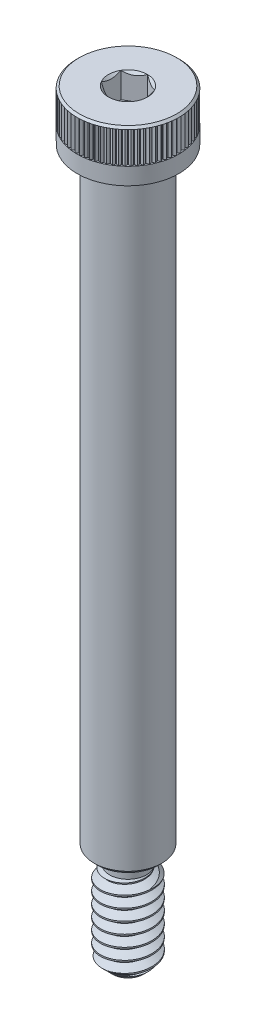
from build123d import *

# Parameters (mm, degrees)
SKETCH1_R          = 4.7625
EXTRUDE1_DEPTH     = 4.7625
CUT_EXTRUDE1_DEPTH = 2.38125
SKETCH4_R          = 3.175
EXTRUDE2_DEPTH     = 57.15
SKETCH5_R          = 2.413
EXTRUDE3_DEPTH     = 9.525
CHAMFER1_SIZE      = 0.9525
CUT_SWEEP1_PITCH   = 1.058333333
CUT_SWEEP1_TO      = 9.525
CUT_EXTRUDE3_DEPTH = 2.980765865
CHAMFER2_SIZE      = 0.194234135
CIRPATTERN2_COUNT  = 72
CHAMFER3_SIZE      = 0.352777778


with BuildPart() as part:
    # Sketch1 → Extrude1 (new body)
    with BuildSketch(Plane(origin=(0, 0, 0), x_dir=(1, 0, 0), z_dir=(0, 1, 0))):
        with Locations(Location((0, 0, 0), (0, 0, 90))):
            Circle(SKETCH1_R)
    extrude(amount=EXTRUDE1_DEPTH)

    # Sketch2 → Cut-Extrude1 (cut)
    with BuildSketch(Plane(origin=(0, 4.7625, 0), x_dir=(-1, 0, 0), z_dir=(0, 1, 0))):
        Polygon((0, -1.833087105), (1.5875, -0.916543552), (1.5875, 0.916543552), (0, 1.833087105), (-1.5875, 0.916543552), (-1.5875, -0.916543552), align=None)
    extrude(amount=-CUT_EXTRUDE1_DEPTH, mode=Mode.SUBTRACT)

    # Sketch4 → Extrude2 (add)
    with BuildSketch(Plane.XZ):
        with Locations(Location((0, 0, 0), (0, 0, 90))):
            Circle(SKETCH4_R)
    extrude(amount=EXTRUDE2_DEPTH)

    # Sketch5 → Extrude3 (add)
    with BuildSketch(Plane.XZ.offset(57.15)):
        with Locations(Location((0, 0, 0), (0, 0, 90))):
            Circle(SKETCH5_R)
    extrude(amount=EXTRUDE3_DEPTH)

    # Chamfer1
    chamfer1_edges = [part.edges().sort_by_distance(p)[0] for p in [
        (0, -66.675, -2.413),
    ]]
    chamfer(chamfer1_edges, length=CHAMFER1_SIZE)

    # Cut-Sweep1: arcs per turn and ends read off the stored shape
    # Cut-Sweep1: the profile of Sketch13 profile screwed along a right-hand helix through 11 turns, 6 arcs to a turn; built about Z, then put on its axis
    cut_sweep1_z = Axis((0, 0, 0), (0, 0, 1))
    cut_sweep1_corners = [(2.4133, 0, -0.132118462), (2.4133, 0, -1.058506538), (1.725592336, 0, -0.661458333), (1.725592336, 0, -0.529166667)]
    with BuildLine(mode=Mode.PRIVATE) as cut_sweep1_profile:
        Line(cut_sweep1_corners[0], cut_sweep1_corners[1])
        Line(cut_sweep1_corners[1], cut_sweep1_corners[2])
        Line(cut_sweep1_corners[2], cut_sweep1_corners[3])
        Line(cut_sweep1_corners[3], cut_sweep1_corners[0])
    cut_sweep1_cap = Face(cut_sweep1_profile.wire())
    cut_sweep1_turn_angles = [0, 30, 60, 90, 120, 150, 180, 210, 240, 270, 300, 330, 360]
    cut_sweep1_turn_weights = [1, 0.8660254037844387, 1, 0.8660254037844387, 1, 0.8660254037844387, 1, 0.8660254037844387, 1, 0.8660254037844387, 1, 0.8660254037844387, 1]
    cut_sweep1_turn_rails = [Edge.make_bspline([Vector(p[0], p[1], 0).rotate(cut_sweep1_z, cut_sweep1_turn_angles[k]) / cut_sweep1_turn_weights[k] + Vector(0, 0, p[2] + CUT_SWEEP1_PITCH * cut_sweep1_turn_angles[k] / 360) for k in range(13)], [0, 0, 0, 1, 1, 2, 2, 3, 3, 4, 4, 5, 5, 6, 6, 6], 2, cut_sweep1_turn_weights) for p in cut_sweep1_corners]
    cut_sweep1_turn_sides = [Face.make_surface_from_curves(cut_sweep1_turn_rails[p[0]], cut_sweep1_turn_rails[p[1]]) for p in [(0, 1), (1, 2), (2, 3), (3, 0)]]
    cut_sweep1 = Plane(origin=(0, -66.675, 0), x_dir=(0.7071067811865439, 0, 0.7071067811865512), z_dir=(0, 1, 0)) * split(Solid(Shell([*[p.moved(Location((0, 0, CUT_SWEEP1_PITCH * i))) for i in range(11) for p in cut_sweep1_turn_sides], cut_sweep1_cap, cut_sweep1_cap.rotate(cut_sweep1_z, 3960).moved(Location((0, 0, CUT_SWEEP1_PITCH * 3960 / 360)))])), bisect_by=Plane.XY.offset(CUT_SWEEP1_TO), keep=Keep.BOTTOM, mode=Mode.PRIVATE)
    add(cut_sweep1, mode=Mode.SUBTRACT)

    # Sketch18 → Cut-Revolve1 (revolve, cut)
    with BuildSketch(Plane.XY, mode=Mode.PRIVATE) as cut_revolve1_sk:
        Polygon((2.413, -57.15), (1.725592336, -57.15), (1.725592336, -58.472916667), (2.413, -59.160324331), align=None)
    revolve(cut_revolve1_sk.sketch.rotate(Axis((0, -57.15, 0), (0, 1, 0)), 270.693182205), axis=Axis((0, -57.15, 0), (0, 1, 0)), mode=Mode.SUBTRACT)

    # Sketch10 → Cut-Extrude3 (cut)
    with BuildSketch(Plane(origin=(0, 1.5875, 0), x_dir=(-1, 0, 0), z_dir=(0, 1, 0))):
        with BuildLine():
            Line((-4.757967155, -0.207737332), (-4.827695054, -0.210781718))
            Line((-4.827695054, -0.210781718), (-4.827695054, 0.210781718))
            Line((-4.827695054, 0.210781718), (-4.757967155, 0.207737332))
            Line((-4.757967155, 0.207737332), (-4.581019273, 0.03078945))
            ThreePointArc((-4.581019273, 0.03078945), (-4.568265865, 0), (-4.581019273, -0.03078945))
            Line((-4.581019273, -0.03078945), (-4.757967155, -0.207737332))
        make_face()
    cut_extrude3 = extrude(amount=CUT_EXTRUDE3_DEPTH, mode=Mode.SUBTRACT)

    # Chamfer2
    chamfer2_edges = [part.edges().sort_by_distance(p)[0] for p in [
        (0, 4.7625, 4.7625),
    ]]
    chamfer(chamfer2_edges, length=CHAMFER2_SIZE - 0.0001)  # a hair under: the kernel refuses the full size

    # CirPattern2: Cut-Extrude3 ×72 about axis
    cirpattern2_axis = Axis((0, 0, 0), (0, 1, 0))
    for i in range(1, CIRPATTERN2_COUNT):
        add(cut_extrude3.rotate(cirpattern2_axis, i * 360 / CIRPATTERN2_COUNT), mode=Mode.SUBTRACT)

    # Fillet1: read off the stored shape, not the designer's step
    # Fillet1 outline → Fillet1 (revolve)
    with BuildSketch(Plane.XY):
        with BuildLine():
            Line((1.725592336, -57.15), (1.725592336, -57.679166667))
            ThreePointArc((1.725592336, -57.679166667), (1.880581664, -57.304989328), (2.254759002, -57.15))
            Line((2.254759002, -57.15), (1.725592336, -57.15))
        make_face()
    revolve(axis=Axis((0, 0, 0), (0, 1, 0)))

    # Chamfer3
    chamfer3_edges = [part.edges().sort_by_distance(p)[0] for p in [
        (0, -57.15, -3.175),
    ]]
    chamfer(chamfer3_edges, length=CHAMFER3_SIZE)

    # Extrude4 cone 1 section (through the dimple's axis) → Extrude4 (revolve, cut)
    with BuildSketch(Plane(origin=(0, 4.7625, 0), x_dir=(0, 0, 1), z_dir=(1, 0, 0))):
        Polygon((0, 0), (1.833087105, 0), (0, 1.833087105), align=None)
    revolve(axis=Axis((0, 4.7625, 0), (0, -1, 0)), mode=Mode.SUBTRACT)


solid = part.part
